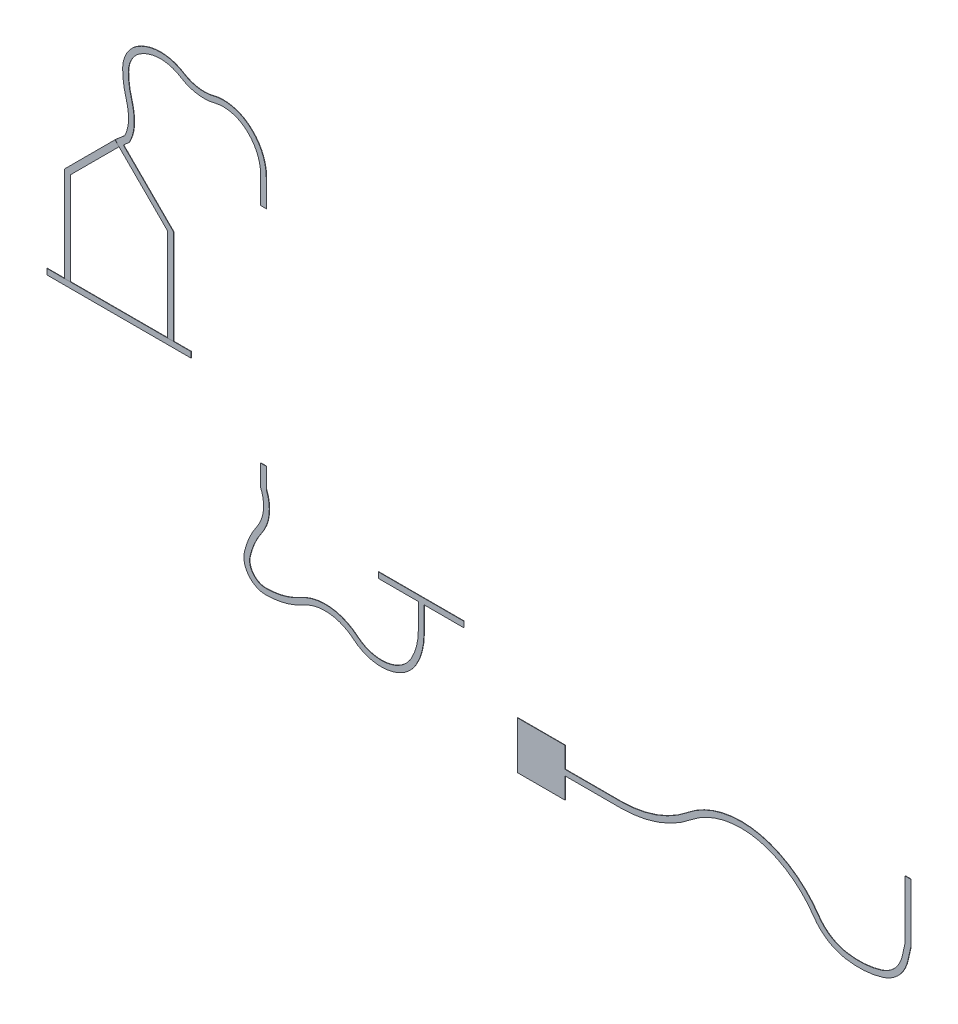
from build123d import *

# Parameters (mm, degrees)
EXTRUDE_THIN4_DEPTH = 2
SKETCH3_W           = 250
SKETCH3_H           = 250
BOSS_EXTRUDE3_DEPTH = 2
SKETCH4_W           = 450
SKETCH4_H           = 30
BOSS_EXTRUDE4_DEPTH = 2
SKETCH5_W           = 30
SKETCH5_H           = 500
BOSS_EXTRUDE5_DEPTH = 2
SKETCH6_W           = 760
SKETCH6_H           = 30
BOSS_EXTRUDE7_DEPTH = 2


# Read off the part's stored shape, not the designer's step: Extrude-Thin4
with BuildPart() as part:
    # Extrude-Thin4 outline → Extrude-Thin4 (new body)
    with BuildSketch(Plane.XY):
        with BuildLine():
            Line((580.329534742, 1867.651110272), (600, 1845))
            Line((600, 1845), (865, 1580))
            Line((865, 1580), (886.213203436, 1601.213203436))
            Line((886.213203436, 1601.213203436), (622.7072175, 1864.719189371))
            Line((622.7072175, 1864.719189371), (653.403971795, 1891.376577537))
            ThreePointArc((653.403971795, 1891.376577537), (673.30803603, 1941.641063842), (680.084696225, 1995.276567319))
            ThreePointArc((680.084696225, 1995.276567319), (676.532858701, 2045.057080452), (665.949306803, 2093.829034142))
            ThreePointArc((665.949306803, 2093.829034142), (653.403971795, 2151.641430576), (649.193760322, 2210.649334548))
            ThreePointArc((649.193760322, 2210.649334548), (665.949306803, 2275.785664392), (712.05624475, 2324.751367457))
            ThreePointArc((712.05624475, 2324.751367457), (818.027452504, 2355.435014772), (923.998660258, 2324.751367457))
            ThreePointArc((923.998660258, 2324.751367457), (1011.215225634, 2291.908815799), (1104.307879422, 2296.281490747))
            ThreePointArc((1104.307879422, 2296.281490747), (1185.947658515, 2298.341290514), (1260.339044564, 2264.648294402))
            ThreePointArc((1260.339044564, 2264.648294402), (1322.673710037, 2189.153082854), (1345, 2093.829034142))
            Line((1345, 2093.829034142), (1345, 1950))
            Line((1345, 1950), (1375, 1950))
            Line((1375, 1950), (1375, 2093.829034142))
            ThreePointArc((1375, 2093.829034142), (1349.553484223, 2202.475160007), (1278.507195252, 2288.521256108))
            ThreePointArc((1278.507195252, 2288.521256108), (1191.90848294, 2327.743136922), (1096.871945536, 2325.345332324))
            ThreePointArc((1096.871945536, 2325.345332324), (1015.894102839, 2321.541704759), (940.027651252, 2350.110220896))
            ThreePointArc((940.027651252, 2350.110220896), (818.027452504, 2385.435014772), (696.027253756, 2350.110220896))
            ThreePointArc((696.027253756, 2350.110220896), (639.673179521, 2290.262029098), (619.193760322, 2210.649334548))
            ThreePointArc((619.193760322, 2210.649334548), (623.707873677, 2147.382116479), (637.158757241, 2085.396700186))
            ThreePointArc((637.158757241, 2085.396700186), (646.836760583, 2040.797766355), (650.084696225, 1995.276567319))
            ThreePointArc((650.084696225, 1995.276567319), (644.874732457, 1951.604472445), (629.537269054, 1910.383630513))
            Line((629.537269054, 1910.383630513), (580.329534742, 1867.651110272))
        make_face()
        Polygon((578.786796564, 1866.213203436), (313.786796564, 1601.213203436), (335, 1580), (600, 1845), align=None)
        with BuildLine():
            Line((1375, 671.37495586), (1375, 776))
            Line((1375, 776), (1345, 776))
            Line((1345, 776), (1345, 665.356203402))
            ThreePointArc((1345, 665.356203402), (1360.128516063, 568.583046436), (1325.921730839, 476.80172071))
            ThreePointArc((1325.921730839, 476.80172071), (1286.101995144, 406.757699666), (1260.339044564, 330.416055643))
            ThreePointArc((1260.339044564, 330.416055643), (1282.260904948, 232.566505826), (1372.547552838, 188.938262968))
            ThreePointArc((1372.547552838, 188.938262968), (1474.465890598, 202.281284498), (1569.514565573, 241.410981413))
            ThreePointArc((1569.514565573, 241.410981413), (1705.577822181, 271.230050509), (1834.187549466, 217.73309052))
            ThreePointArc((1834.187549466, 217.73309052), (1945.045622854, 167.201036401), (2066.069190222, 181.211642034))
            ThreePointArc((2066.069190222, 181.211642034), (2124.350152694, 217.73309052), (2166.78545843, 271.860085755))
            ThreePointArc((2166.78545843, 271.860085755), (2195.300446849, 345.621452904), (2205, 424.105607464))
            Line((2205, 424.105607464), (2205, 560))
            Line((2205, 560), (2175, 560))
            Line((2175, 560), (2175, 424.105607464))
            ThreePointArc((2175, 424.105607464), (2166.203072501, 352.92506886), (2140.341645499, 286.02782226))
            ThreePointArc((2140.341645499, 286.02782226), (2104.28074565, 240.031496313), (2054.754439327, 208.996105537))
            ThreePointArc((2054.754439327, 208.996105537), (1949.713097583, 196.835723503), (1853.494807006, 240.694575801))
            ThreePointArc((1853.494807006, 240.694575801), (1708.250974391, 301.110717457), (1554.589589012, 267.434914142))
            ThreePointArc((1554.589589012, 267.434914142), (1466.743131436, 231.270230511), (1372.547552838, 218.938262968))
            ThreePointArc((1372.547552838, 218.938262968), (1305.765674919, 251.2085494), (1289.550840964, 323.58444155))
            ThreePointArc((1289.550840964, 323.58444155), (1313.479960119, 394.492014451), (1350.465289002, 459.550235189))
            ThreePointArc((1350.465289002, 459.550235189), (1389.627244127, 562.34751421), (1375, 671.37495586))
        make_face()
        with BuildLine():
            Line((4767.469655509, 280.907659612), (4767.469655509, 590))
            Line((4767.469655509, 590), (4737.469655509, 590))
            Line((4737.469655509, 590), (4737.469655509, 284.332140954))
            ThreePointArc((4737.469655509, 284.332140954), (4729.867341385, 251.051330007), (4722.430778015, 217.73309052))
            ThreePointArc((4722.430778015, 217.73309052), (4683.652807685, 143.257064619), (4612.729150001, 98.30993793))
            ThreePointArc((4612.729150001, 98.30993793), (4521.841227213, 81.341666779), (4429.499055865, 85.974174218))
            ThreePointArc((4429.499055865, 85.974174218), (4345.775905249, 118.424580356), (4281.585721472, 181.211642034))
            ThreePointArc((4281.585721472, 181.211642034), (4169.554635372, 301.060770828), (4025.898417544, 380.292513234))
            ThreePointArc((4025.898417544, 380.292513234), (3799.09677669, 400.468186566), (3591.824622503, 306.211642034))
            ThreePointArc((3591.824622503, 306.211642034), (3427.213067923, 213.395077999), (3240.997856648, 181.211642034))
            Line((3240.997856648, 181.211642034), (2947.198336269, 181.211642034))
            Line((2947.198336269, 181.211642034), (2947.198336269, 151.211642034))
            Line((2947.198336269, 151.211642034), (3240.997856648, 151.211642034))
            ThreePointArc((3240.997856648, 151.211642034), (3437.282062755, 185.13529486), (3610.794463195, 282.970619163))
            ThreePointArc((3610.794463195, 282.970619163), (3804.143731696, 370.895762838), (4015.710652135, 352.075329888))
            ThreePointArc((4015.710652135, 352.075329888), (4151.124134763, 277.389762246), (4256.727078796, 164.417360736))
            ThreePointArc((4256.727078796, 164.417360736), (4329.535042979, 93.20089322), (4424.498350336, 56.393894568))
            ThreePointArc((4424.498350336, 56.393894568), (4523.856382389, 51.409424136), (4621.649676761, 69.666889868))
            ThreePointArc((4621.649676761, 69.666889868), (4705.746187648, 122.962174577), (4751.726500995, 211.27084516))
            ThreePointArc((4751.726500995, 211.27084516), (4759.507066826, 246.109827809), (4767.469655509, 280.907659612))
        make_face()
    extrude(amount=EXTRUDE_THIN4_DEPTH)

    # Sketch3 → Boss-Extrude3 (add)
    with BuildSketch(Plane.XY):
        with Locations((2822.198336269, 165.681992538)):
            Rectangle(SKETCH3_W, SKETCH3_H)
    extrude(amount=BOSS_EXTRUDE3_DEPTH)

    # Sketch4 → Boss-Extrude4 (add)
    with BuildSketch(Plane.XY):
        with Locations((2190, 575)):
            Rectangle(SKETCH4_W, SKETCH4_H)
    extrude(amount=BOSS_EXTRUDE4_DEPTH)

    # Sketch5 → Boss-Extrude5 (add)
    with BuildSketch(Plane.XY):
        with Locations((328.786796564, 1351.213203436)):
            Rectangle(SKETCH5_W, SKETCH5_H)
        with Locations((871.213203436, 1351.213203436)):
            Rectangle(SKETCH5_W, SKETCH5_H)
    extrude(amount=BOSS_EXTRUDE5_DEPTH)


with BuildPart() as body_2:
    # Sketch6 → Boss-Extrude7 (new body)
    with BuildSketch(Plane.XY):
        with Locations((600, 1086.203203436)):
            Rectangle(SKETCH6_W, SKETCH6_H)
    extrude(amount=BOSS_EXTRUDE7_DEPTH)


solid = Compound([part.part, body_2.part])
